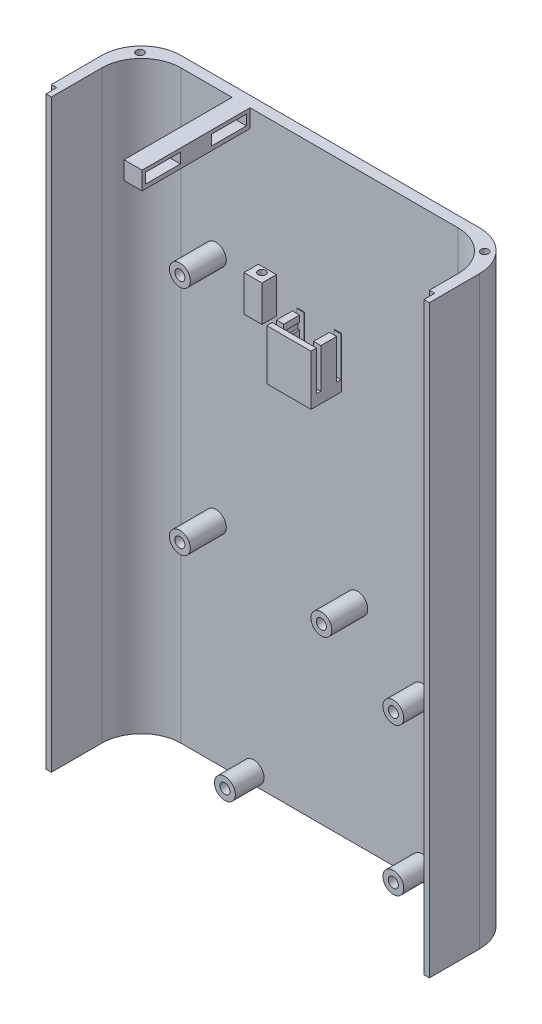
from build123d import *

# Parameters (mm, degrees)
EXTRUDE_1_DEPTH       = 162.5
SKETCH_2_W            = 1.5
SKETCH_2_H            = 162.5
EXTRUDE_2_DEPTH       = 3
SKETCH_2_4_W          = 1.5
SKETCH_2_4_H          = 162.5
CUT_EXTRUDE_2_DEPTH   = 3
SKETCH_3_R            = 1.05
CUT_EXTRUDE_3_DEPTH   = 4
CUT_EXTRUDE_START     = -4
SKETCH_4_R            = 1.05
CUT_EXTRUDE_4_DEPTH   = 4
SKETCH_6_R            = 2.9
SKETCH_6_R_2          = 1.4
EXTRUDE_1_2_DEPTH     = 10
SKETCH_7_R            = 2.9
SKETCH_7_R_2          = 1.4
EXTRUDE_2_2_DEPTH     = 8
EXTRUDE_4_DEPTH       = 8.5
CUT_EXTRUDE_6_REACH   = 176.56
SKETCH_13_W           = 1.2
SKETCH_13_H           = 11
EXTRUDE_START         = 1.4
EXTRUDE_5_OUTLINE_W   = 0.5
EXTRUDE_5_OUTLINE_H   = 1.8
EXTRUDE_5_DEPTH       = 4.4
EXTRUDE_5_2_OUTLINE_W = 5
EXTRUDE_5_2_OUTLINE_H = 10
EXTRUDE_5_2_DEPTH     = 4
EXTRUDE_START_2       = 116
EXTRUDE_6_OUTLINE_R   = 1.05
EXTRUDE_6_DEPTH       = 10
EXTRUDE_START_3       = 157.5
EXTRUDE_6_2_OUTLINE_W = 5
EXTRUDE_6_2_OUTLINE_H = 30
EXTRUDE_6_2_DEPTH     = 5
EXTRUDE_START_4       = -7.5
EXTRUDE_7_OUTLINE_W   = 2.9
EXTRUDE_7_OUTLINE_H   = 2.85
EXTRUDE_7_DEPTH       = 9.65
EXTRUDE_START_5       = 10.85
EXTRUDE_7_2_OUTLINE_W = 2.9
EXTRUDE_7_2_OUTLINE_H = 2.85
EXTRUDE_7_2_DEPTH     = 9.65
EXTRUDE_START_6       = -1.5
EXTRUDE_7_3_OUTLINE_W = 8.3
EXTRUDE_7_3_OUTLINE_H = 11.95
EXTRUDE_7_3_DEPTH     = 1.5


# Read off the part's stored shape, not the designer's step: 凸台-拉伸5, 凸台-拉伸6, 凸台-拉伸7
with BuildPart() as part:
    # 草图1 → Extrude 1 (new body)
    with BuildSketch(Plane(origin=(0, 0, 0), x_dir=(1, 0, 0), z_dir=(0, 1, 0))):
        with BuildLine():
            Line((-3, 0), (-3, 14))
            ThreePointArc((-3, 14), (0.221825407, 21.778174593), (8, 25))
            Line((8, 25), (91, 25))
            ThreePointArc((91, 25), (98.778174593, 21.778174593), (102, 14))
            Line((102, 14), (102, 0))
            Line((102, 0), (99, 0))
            Line((99, 0), (99, 11))
            ThreePointArc((99, 11), (95.778174593, 18.778174593), (88, 22))
            Line((88, 22), (11, 22))
            ThreePointArc((11, 22), (3.221825407, 18.778174593), (0, 11))
            Line((0, 11), (0, 0))
            Line((0, 0), (-3, 0))
        make_face()
    extrude(amount=EXTRUDE_1_DEPTH)

    # 草图2 → Extrude 2 (add)
    with BuildSketch(Plane.XY):
        with Locations((-0.75, 81.25)):
            Rectangle(SKETCH_2_W, SKETCH_2_H)
    extrude(amount=EXTRUDE_2_DEPTH)

    # 草图2<4> → 切除-拉伸2 (cut)
    with BuildSketch(Plane.XY):
        with Locations((99.75, 81.25)):
            Rectangle(SKETCH_2_4_W, SKETCH_2_4_H)
    extrude(amount=-CUT_EXTRUDE_2_DEPTH, mode=Mode.SUBTRACT)

    # 草图3 → 切除-拉伸3 (cut)
    with BuildSketch(Plane(origin=(0, 162.5, 0), x_dir=(1, 0, 0), z_dir=(0, 1, 0))):
        with Locations(Location((1.61916848, 20, 0), (0, 0, 270))):
            Circle(SKETCH_3_R)
        with Locations(Location((97.38083152, 20, 0), (0, 0, 270))):
            Circle(SKETCH_3_R)
    extrude(amount=-CUT_EXTRUDE_3_DEPTH, mode=Mode.SUBTRACT)

    # 草图4 → 切除-拉伸4 (cut)
    with BuildSketch(Plane.XZ.offset(CUT_EXTRUDE_START)):
        with Locations(Location((1.61916848, -20, 0), (0, 0, 90))):
            Circle(SKETCH_4_R)
        with Locations(Location((97.38083152, -20, 0), (0, 0, 90))):
            Circle(SKETCH_4_R)
    extrude(amount=CUT_EXTRUDE_4_DEPTH, mode=Mode.SUBTRACT)

    # 草图6 → Extrude 1 2 (add)
    # profile 1 of 3: a face of its own
    with BuildSketch(Plane.XY.offset(-22)):
        with Locations((20.69, 122.5)):
            Circle(SKETCH_6_R)
        with Locations((20.69, 122.5)):
            Circle(SKETCH_6_R_2, mode=Mode.SUBTRACT)
    # profile 2 of 3: a face of its own
    with BuildSketch(Plane.XY.offset(-22)):
        with Locations((20.69, 58.19)):
            Circle(SKETCH_6_R)
        with Locations((20.69, 58.19)):
            Circle(SKETCH_6_R_2, mode=Mode.SUBTRACT)
    # profile 3 of 3: a face of its own
    with BuildSketch(Plane.XY.offset(-22)):
        with Locations((60, 58.19)):
            Circle(SKETCH_6_R)
        with Locations((60, 58.19)):
            Circle(SKETCH_6_R_2, mode=Mode.SUBTRACT)
    extrude(amount=EXTRUDE_1_2_DEPTH)

    # 草图7 → Extrude 2 2 (add)
    # profile 1 of 3: a face of its own
    with BuildSketch(Plane.XY.offset(-22)):
        with Locations((78, 4)):
            Circle(SKETCH_7_R)
        with Locations((78, 4)):
            Circle(SKETCH_7_R_2, mode=Mode.SUBTRACT)
    # profile 2 of 3: a face of its own
    with BuildSketch(Plane.XY.offset(-22)):
        with Locations((31.2, 3.2)):
            Circle(SKETCH_7_R)
        with Locations((31.2, 3.2)):
            Circle(SKETCH_7_R_2, mode=Mode.SUBTRACT)
    # profile 3 of 3: a face of its own
    with BuildSketch(Plane.XY.offset(-22)):
        with Locations((78, 45)):
            Circle(SKETCH_7_R)
        with Locations((78, 45)):
            Circle(SKETCH_7_R_2, mode=Mode.SUBTRACT)
    extrude(amount=EXTRUDE_2_2_DEPTH)

    # 草图12 → 凸台-拉伸4 (add)
    with BuildSketch(Plane.XY.offset(-22)):
        Polygon((45.35, 120.9), (45.35, 108.95), (53.65, 108.95), (53.65, 120.9), (55.65, 120.9), (55.65, 106.9), (43.35, 106.9), (43.35, 120.9), align=None)
    extrude(amount=EXTRUDE_4_DEPTH)

    # 切除-拉伸6: up to this face of the body (flat: up to its plane)
    cut_extrude_6_end = Plane(part.part.faces().sort_by_distance((43.35, 113.9, -17.75))[0])
    # 草图13 → 切除-拉伸6 (cut, up to the picked face)
    with BuildSketch(Plane(origin=(55.65, 0, 0), x_dir=(0, 0, -1), z_dir=(1, 0, 0)), mode=Mode.PRIVATE) as cut_extrude_6_sk1:
        with Locations((15.6, 115.4)):
            Rectangle(SKETCH_13_W, SKETCH_13_H)
    cut_extrude_6_tool1 = split(extrude(cut_extrude_6_sk1.sketch, amount=-CUT_EXTRUDE_6_REACH, mode=Mode.PRIVATE), bisect_by=cut_extrude_6_end, keep=Keep.BOTH, mode=Mode.PRIVATE)
    # 草图13 → 切除-拉伸6 (cut, up to the picked face)
    with BuildSketch(Plane(origin=(55.65, 0, 0), x_dir=(0, 0, -1), z_dir=(1, 0, 0)), mode=Mode.PRIVATE) as cut_extrude_6_sk2:
        with Locations((21.2, 115.4)):
            Rectangle(SKETCH_13_W, SKETCH_13_H)
    cut_extrude_6_tool2 = split(extrude(cut_extrude_6_sk2.sketch, amount=-CUT_EXTRUDE_6_REACH, mode=Mode.PRIVATE), bisect_by=cut_extrude_6_end, keep=Keep.BOTH, mode=Mode.PRIVATE)
    add(cut_extrude_6_tool1.solids().sort_by(Axis((55.65, 115.4, -15.6), (-1, 0, 0)))[0], mode=Mode.SUBTRACT)
    add(cut_extrude_6_tool2.solids().sort_by(Axis((55.65, 115.4, -21.2), (-1, 0, 0)))[0], mode=Mode.SUBTRACT)

    # 凸台-拉伸5 outline → 凸台-拉伸5 (cut)
    with BuildSketch(Plane.XY.offset(-22).offset(EXTRUDE_START)):
        with Locations((53.9, 118.25)):
            Rectangle(EXTRUDE_5_OUTLINE_W, EXTRUDE_5_OUTLINE_H)
        with Locations((45.1, 118.25)):
            Rectangle(EXTRUDE_5_OUTLINE_W, EXTRUDE_5_OUTLINE_H)
    extrude(amount=EXTRUDE_5_DEPTH, mode=Mode.SUBTRACT)

    # Extrude 5 2 outline → Extrude 5 2 (add)
    with BuildSketch(Plane.XY.offset(-22)):
        with Locations((35, 121)):
            Rectangle(EXTRUDE_5_2_OUTLINE_W, EXTRUDE_5_2_OUTLINE_H)
    extrude(amount=EXTRUDE_5_2_DEPTH)

    # 凸台-拉伸6 outline → 凸台-拉伸6 (cut)
    with BuildSketch(Plane(origin=(0, 0, 0), x_dir=(1, 0, 0), z_dir=(0, 1, 0)).offset(EXTRUDE_START_2)):
        with Locations((35, 20.5)):
            Circle(EXTRUDE_6_OUTLINE_R)
    extrude(amount=EXTRUDE_6_DEPTH, mode=Mode.SUBTRACT)

    # Extrude 6 2 outline → Extrude 6 2 (add)
    with BuildSketch(Plane(origin=(0, 0, 0), x_dir=(1, 0, 0), z_dir=(0, 1, 0)).offset(EXTRUDE_START_3)):
        with Locations((27.7, 7)):
            Rectangle(EXTRUDE_6_2_OUTLINE_W, EXTRUDE_6_2_OUTLINE_H)
    extrude(amount=EXTRUDE_6_2_DEPTH)

    # 凸台-拉伸7 outline → 凸台-拉伸7 (cut)
    with BuildSketch(Plane.XY.offset(-13.5).offset(EXTRUDE_START_4)):
        with Locations((28.75, 160.075)):
            Rectangle(EXTRUDE_7_OUTLINE_W, EXTRUDE_7_OUTLINE_H)
    extrude(amount=EXTRUDE_7_DEPTH, mode=Mode.SUBTRACT)

    # Extrude 7 2 outline → Extrude 7 2 (cut)
    with BuildSketch(Plane.XY.offset(-13.5).offset(EXTRUDE_START_5)):
        with Locations((28.75, 160.075)):
            Rectangle(EXTRUDE_7_2_OUTLINE_W, EXTRUDE_7_2_OUTLINE_H)
    extrude(amount=EXTRUDE_7_2_DEPTH, mode=Mode.SUBTRACT)

    # Extrude 7 3 outline → Extrude 7 3 (add)
    with BuildSketch(Plane.XY.offset(-13.5).offset(EXTRUDE_START_6)):
        with Locations((49.5, 114.925)):
            Rectangle(EXTRUDE_7_3_OUTLINE_W, EXTRUDE_7_3_OUTLINE_H)
    extrude(amount=EXTRUDE_7_3_DEPTH)


solid = part.part
